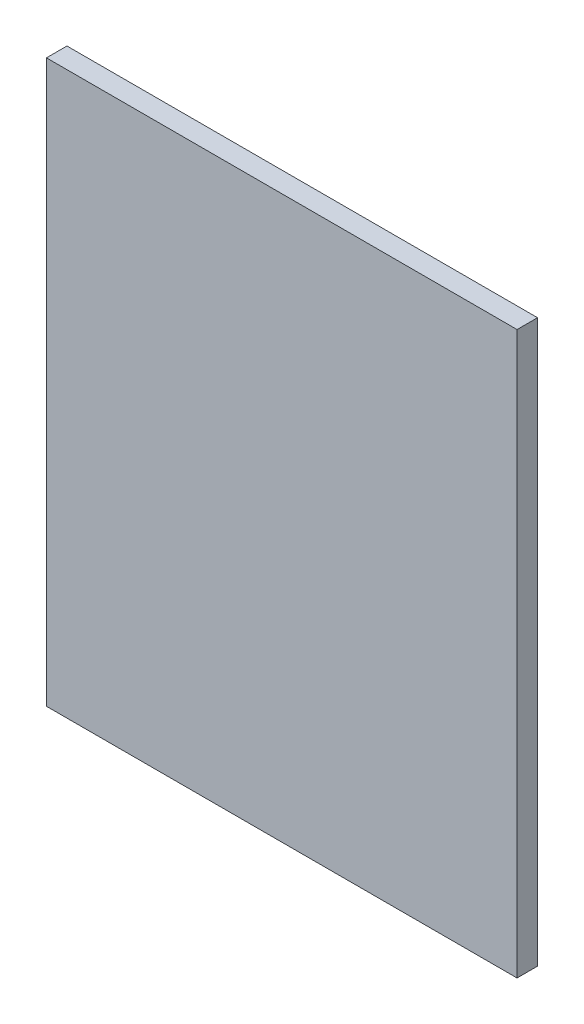
from build123d import *

# Parameters (mm, degrees)
SKETCH1_W           = 145.796
SKETCH1_H           = 173.99
BOSS_EXTRUDE1_DEPTH = 6.35


with BuildPart() as part:
    # Sketch1 → Boss-Extrude1 (new body)
    with BuildSketch(Plane.XY):
        with Locations((0, 86.995)):
            Rectangle(SKETCH1_W, SKETCH1_H)
    extrude(amount=BOSS_EXTRUDE1_DEPTH)


solid = part.part
